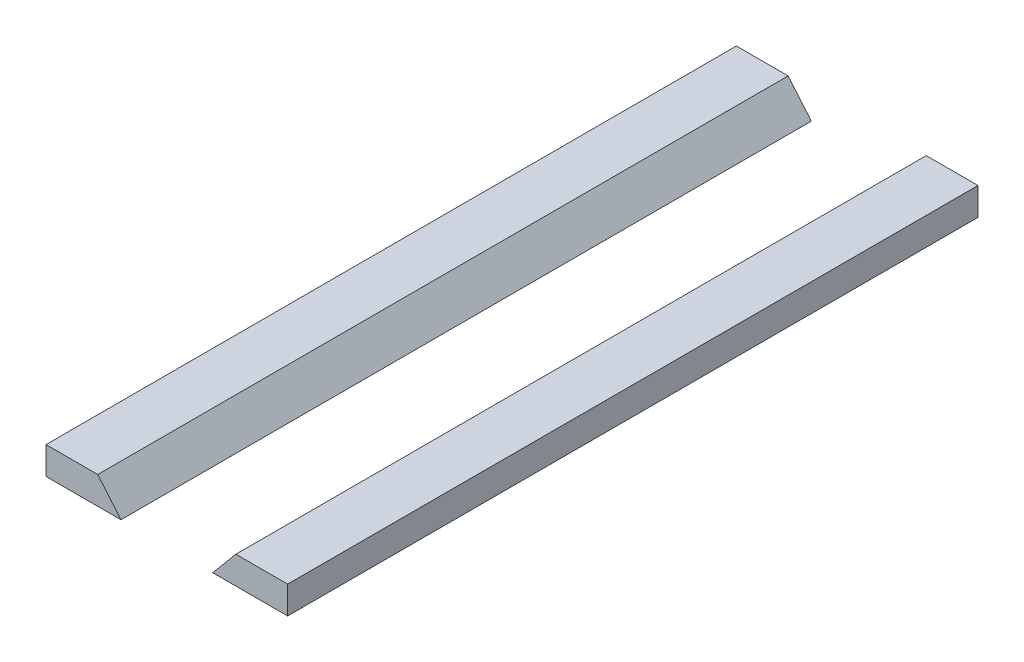
from build123d import *

# Parameters (mm, degrees)
DODANIE_WYCI_GNI_CIE1_DEPTH   = 100
DODANIE_WYCI_GNI_CIE1_2_DEPTH = 100


with BuildPart() as part:
    # Szkic1 → Dodanie-wyciągnięcie1 (new body)
    with BuildSketch(Plane.XY):
        Polygon((-6.643601475, -2), (-10, 2), (-17.5, 2), (-17.5, -2), align=None)
    extrude(amount=-DODANIE_WYCI_GNI_CIE1_DEPTH)


with BuildPart() as body_2:
    # Szkic1 → Dodanie-wyci_gni_cie1 2 (new body)
    with BuildSketch(Plane.XY):
        Polygon((17.5, 2), (10, 2), (6.643601475, -2), (17.5, -2), align=None)
    extrude(amount=-DODANIE_WYCI_GNI_CIE1_2_DEPTH)


solid = Compound([part.part, body_2.part])
